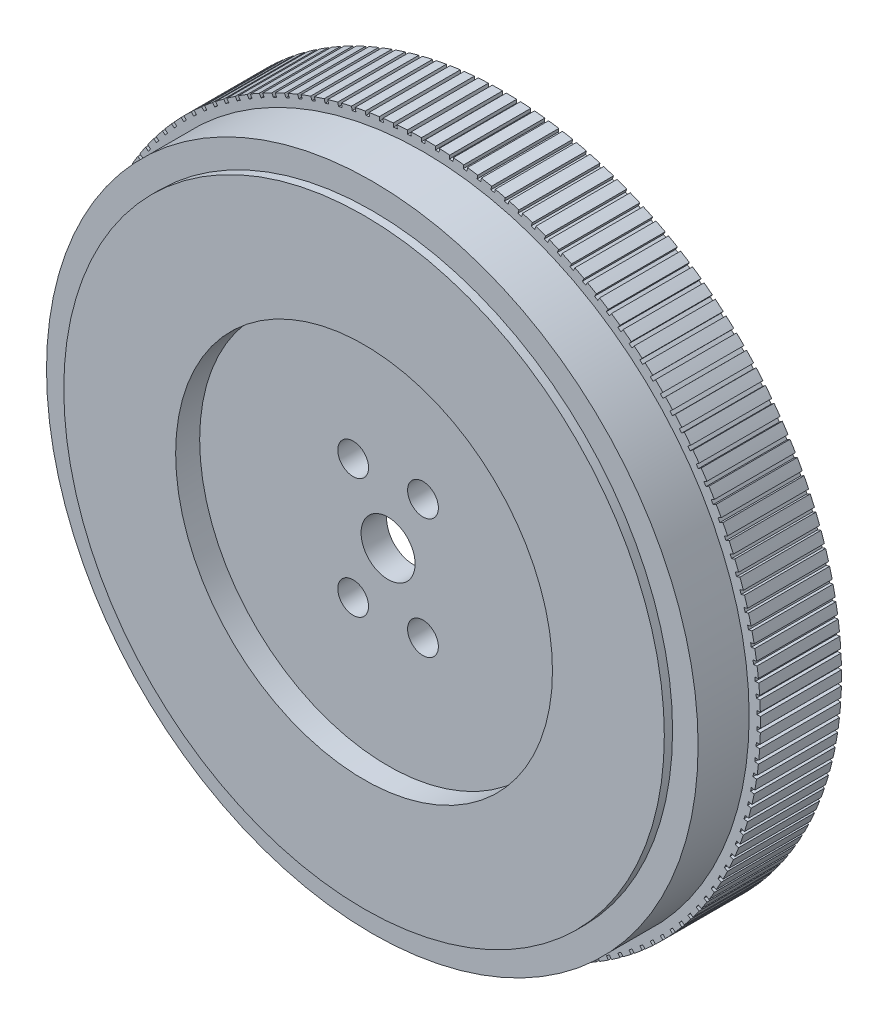
from build123d import *

# Parameters (mm, degrees)
SKETCH1_R           = 44.9
BOSS_EXTRUDE1_DEPTH = 10.8
SKETCH2_R           = 43.4
BOSS_EXTRUDE2_DEPTH = 6.8
SKETCH3_R           = 40
BOSS_EXTRUDE3_DEPTH = 1.1
SKETCH4_R           = 25.1
CUT_EXTRUDE1_DEPTH  = 3.2
SKETCH5_R           = 33.85
CUT_EXTRUDE2_DEPTH  = 12.1
SKETCH6_R           = 3.6
SKETCH6_R_2         = 2.05
CUT_EXTRUDE3_DEPTH  = 66.362603987
SKETCH7_W           = 0.5
SKETCH7_H           = 0.5
CUT_EXTRUDE4_DEPTH  = 67.194486175


with BuildPart() as part:
    # Sketch1 → Boss-Extrude1 (new body)
    with BuildSketch(Plane.XY):
        Circle(SKETCH1_R)
    extrude(amount=BOSS_EXTRUDE1_DEPTH)

    # Sketch2 → Boss-Extrude2 (add)
    with BuildSketch(Plane.XY.offset(10.8)):
        Circle(SKETCH2_R)
    extrude(amount=BOSS_EXTRUDE2_DEPTH)

    # Sketch3 → Boss-Extrude3 (add)
    with BuildSketch(Plane.XY.offset(17.6)):
        Circle(SKETCH3_R)
    extrude(amount=BOSS_EXTRUDE3_DEPTH)

    # Sketch4 → Cut-Extrude1 (cut)
    with BuildSketch(Plane.XY.offset(18.7)):
        Circle(SKETCH4_R)
    extrude(amount=-CUT_EXTRUDE1_DEPTH, mode=Mode.SUBTRACT)

    # Sketch5 → Cut-Extrude2 (cut)
    with BuildSketch(Plane(origin=(0, 0, 0), x_dir=(-1, 0, 0), z_dir=(0, 0, -1))):
        Circle(SKETCH5_R)
    extrude(amount=-CUT_EXTRUDE2_DEPTH, mode=Mode.SUBTRACT)

    # Sketch6 → Cut-Extrude3 (cut, through all)
    with BuildSketch(Plane.XY.offset(15.5)):
        Circle(SKETCH6_R)
        with Locations((4.65, 8)):
            Circle(SKETCH6_R_2)
        with Locations((-4.65, 8)):
            Circle(SKETCH6_R_2)
        with Locations((-4.65, -8)):
            Circle(SKETCH6_R_2)
        with Locations((4.65, -8)):
            Circle(SKETCH6_R_2)
    extrude(amount=-CUT_EXTRUDE3_DEPTH, mode=Mode.SUBTRACT)

    # Sketch7 → Cut-Extrude4 (cut, through all)
    with BuildSketch(Plane(origin=(0, 0, 0), x_dir=(-1, 0, 0), z_dir=(0, 0, -1))):
        Polygon((1.631584326, 44.898478744), (1.610646499, 44.398917329), (2.110207914, 44.377979502), (2.131145741, 44.877540917), align=None)
        with Locations((0, 44.67741881)):
            Rectangle(SKETCH7_W, SKETCH7_H)
        Polygon((3.510306298, 44.79077149), (3.468467376, 44.29252506), (3.966713806, 44.250686139), (4.008552727, 44.748932568), align=None)
        Polygon((5.38287, 44.604486002), (5.320203383, 44.108428652), (5.816260734, 44.045762035), (5.878927351, 44.541819385), align=None)
        Polygon((7.245990319, 44.33994909), (7.162605946, 43.846951071), (7.655603964, 43.763566698), (7.738988337, 44.256564716), align=None)
        Polygon((9.096398709, 43.997624839), (8.992442863, 43.508551039), (9.481516664, 43.404595193), (9.585472509, 43.893668994), align=None)
        Polygon((10.930848924, 43.578113804), (10.806503981, 43.093822224), (11.290795561, 42.96947728), (11.415140505, 43.453768861), align=None)
        Polygon((12.746122716, 43.08215195), (12.601606818, 42.603492201), (13.080266567, 42.458976303), (13.224782465, 42.937636052), align=None)
        Polygon((14.539035478, 42.510609362), (14.374602155, 42.038421177), (14.84679034, 41.873987853), (15.011223663, 42.346176039), align=None)
        Polygon((16.306441831, 41.86448872), (16.122379555, 41.399600477), (16.587267798, 41.2155382), (16.771330074, 41.680426443), align=None)
        Polygon((18.045241145, 41.144923539), (17.841872823, 40.68815081), (18.298645552, 40.484782488), (18.502013873, 40.941555217), align=None)
        Polygon((19.752382973, 40.35317618), (19.530065383, 39.9053203), (19.977921264, 39.683002711), (20.200238853, 40.130858591), align=None)
        Polygon((21.42487241, 39.490635639), (21.183995573, 39.052482299), (21.622148913, 38.811605462), (21.86302575, 39.249758802), align=None)
        Polygon((23.05977534, 38.558815104), (22.800761835, 38.131132974), (23.228443966, 37.872119469), (23.48745747, 38.299801599), align=None)
        Polygon((24.654223589, 37.559349305), (24.377527814, 37.142888684), (24.793988435, 36.86619291), (25.070684209, 37.28265353), align=None)
        Polygon((26.205419952, 36.493991644), (25.911527326, 36.089483147), (26.316035823, 35.795590521), (26.609928449, 36.200099018), align=None)
        Polygon((27.710643103, 35.364611121), (27.400069213, 34.972764393), (27.791915942, 34.662190502), (28.102489832, 35.054037231), align=None)
        Polygon((29.167252371, 34.173189054), (28.840542069, 33.794691526), (29.219039597, 33.467981224), (29.545749899, 33.846478752), align=None)
        Polygon((30.572692367, 32.9218156), (30.230418814, 32.557331287), (30.594903127, 32.215057734), (30.93717668, 32.579542047), align=None)
        Polygon((31.924497471, 31.612686095), (31.567261131, 31.262854425), (31.917092802, 30.905618085), (32.274329142, 31.255449756), align=None)
        Polygon((33.220296159, 30.248097197), (32.848723747, 29.913531894), (33.18328905, 29.541959481), (33.554861463, 29.876524784), align=None)
        Polygon((34.45781516, 28.830442858), (34.072558538, 28.511730863), (34.391270533, 28.126474242), (34.776527155, 28.445186237), align=None)
        Polygon((35.634883443, 27.362210125), (35.236618484, 27.059910568), (35.538918042, 26.661645609), (35.937183001, 26.963945166), align=None)
        Polygon((36.749436033, 25.845974778), (36.338861428, 25.560617995), (36.624218212, 25.15004339), (37.034792816, 25.435400174), align=None)
        Polygon((37.799517624, 24.284396809), (37.377353661, 24.016483412), (37.645267058, 23.594319449), (38.067431021, 23.862232846), align=None)
        Polygon((38.783286016, 22.680215756), (38.350273314, 22.430215756), (38.600273314, 21.997203054), (39.033286016, 22.247203054), align=None)
        Polygon((39.699015347, 21.036245898), (39.255913557, 20.80459788), (39.487561575, 20.361496091), (39.930663364, 20.593144108), align=None)
        Polygon((40.545099114, 19.355371316), (40.092685588, 19.14248167), (40.305575234, 18.690068144), (40.75798876, 18.90295779), align=None)
        Polygon((41.320053001, 17.640540836), (40.859121425, 17.446783043), (41.052879218, 16.985851467), (41.513810794, 17.17960926), align=None)
        Polygon((42.022517473, 15.894762853), (41.553876479, 15.720476829), (41.728162502, 15.251835835), (42.196803497, 15.426121858), align=None)
        Polygon((42.651260171, 14.121100055), (42.175731913, 13.966591558), (42.33024041, 13.4910633), (42.805768669, 13.645571797), align=None)
        Polygon((43.205178066, 12.322664049), (42.723596782, 12.188204139), (42.858056693, 11.706622855), (43.339637976, 11.841082765), align=None)
        Polygon((43.683299397, 10.502609903), (43.196509945, 10.388434468), (43.31068538, 9.901645016), (43.797474832, 10.015820451), align=None)
        Polygon((44.084785377, 8.66413061), (43.593641752, 8.570439953), (43.687332409, 8.079296328), (44.178476034, 8.172986985), align=None)
        Polygon((44.408931663, 6.810451489), (43.914295497, 6.737409974), (43.987337011, 6.242773808), (44.481973178, 6.315815322), align=None)
        Polygon((44.655169593, 4.944824521), (44.157908646, 4.892560289), (44.210172877, 4.395299341), (44.707433825, 4.447563573), align=None)
        Polygon((44.823067182, 3.07052265), (44.324053818, 3.039127391), (44.355449078, 2.540114026), (44.854462442, 2.571509286), align=None)
        Polygon((44.91232988, 1.19083404), (44.412439538, 1.18036283), (44.422910748, 0.680472488), (44.92280109, 0.690943698), align=None)
        Polygon((44.92280109, -0.690943698), (44.422910748, -0.680472488), (44.412439538, -1.18036283), (44.91232988, -1.19083404), align=None)
        Polygon((44.854462442, -2.571509286), (44.355449078, -2.540114026), (44.324053818, -3.039127391), (44.823067182, -3.07052265), align=None)
        Polygon((44.707433825, -4.447563573), (44.210172877, -4.395299341), (44.157908646, -4.892560289), (44.655169593, -4.944824521), align=None)
        Polygon((44.481973178, -6.315815322), (43.987337011, -6.242773808), (43.914295497, -6.737409974), (44.408931663, -6.810451489), align=None)
        Polygon((44.178476034, -8.172986985), (43.687332409, -8.079296328), (43.593641752, -8.570439953), (44.084785377, -8.66413061), align=None)
        Polygon((43.797474832, -10.015820451), (43.31068538, -9.901645016), (43.196509945, -10.388434468), (43.683299397, -10.502609903), align=None)
        Polygon((43.339637976, -11.841082765), (42.858056693, -11.706622855), (42.723596782, -12.188204139), (43.205178066, -12.322664049), align=None)
        Polygon((42.805768669, -13.645571797), (42.33024041, -13.4910633), (42.175731913, -13.966591558), (42.651260171, -14.121100055), align=None)
        Polygon((42.196803497, -15.426121858), (41.728162502, -15.251835835), (41.553876479, -15.720476829), (42.022517473, -15.894762853), align=None)
        Polygon((41.513810794, -17.17960926), (41.052879218, -16.985851467), (40.859121425, -17.446783043), (41.320053001, -17.640540836), align=None)
        Polygon((40.75798876, -18.90295779), (40.305575234, -18.690068144), (40.092685588, -19.14248167), (40.545099114, -19.355371316), align=None)
        Polygon((39.930663364, -20.593144108), (39.487561575, -20.361496091), (39.255913557, -20.80459788), (39.699015347, -21.036245898), align=None)
        Polygon((39.033286016, -22.247203054), (38.600273314, -21.997203054), (38.350273314, -22.430215756), (38.783286016, -22.680215756), align=None)
        Polygon((38.067431021, -23.862232846), (37.645267058, -23.594319449), (37.377353661, -24.016483412), (37.799517624, -24.284396809), align=None)
        Polygon((37.034792816, -25.435400174), (36.624218212, -25.15004339), (36.338861428, -25.560617995), (36.749436033, -25.845974778), align=None)
        Polygon((35.937183001, -26.963945166), (35.538918042, -26.661645609), (35.236618484, -27.059910568), (35.634883443, -27.362210125), align=None)
        Polygon((34.776527155, -28.445186237), (34.391270533, -28.126474242), (34.072558538, -28.511730863), (34.45781516, -28.830442858), align=None)
        Polygon((33.554861463, -29.876524784), (33.18328905, -29.541959481), (32.848723747, -29.913531894), (33.220296159, -30.248097197), align=None)
        Polygon((32.274329142, -31.255449756), (31.917092802, -30.905618085), (31.567261131, -31.262854425), (31.924497471, -31.612686095), align=None)
        Polygon((30.93717668, -32.579542047), (30.594903127, -32.215057734), (30.230418814, -32.557331287), (30.572692367, -32.9218156), align=None)
        Polygon((29.545749899, -33.846478752), (29.219039597, -33.467981224), (28.840542069, -33.794691526), (29.167252371, -34.173189054), align=None)
        Polygon((28.102489832, -35.054037231), (27.791915942, -34.662190502), (27.400069213, -34.972764393), (27.710643103, -35.364611121), align=None)
        Polygon((26.609928449, -36.200099018), (26.316035823, -35.795590521), (25.911527326, -36.089483147), (26.205419952, -36.493991644), align=None)
        Polygon((25.070684209, -37.28265353), (24.793988435, -36.86619291), (24.377527814, -37.142888684), (24.654223589, -37.559349305), align=None)
        Polygon((23.48745747, -38.299801599), (23.228443966, -37.872119469), (22.800761835, -38.131132974), (23.05977534, -38.558815104), align=None)
        Polygon((21.86302575, -39.249758802), (21.622148913, -38.811605462), (21.183995573, -39.052482299), (21.42487241, -39.490635639), align=None)
        Polygon((20.200238853, -40.130858591), (19.977921264, -39.683002711), (19.530065383, -39.9053203), (19.752382973, -40.35317618), align=None)
        Polygon((18.502013873, -40.941555217), (18.298645552, -40.484782488), (17.841872823, -40.68815081), (18.045241145, -41.144923539), align=None)
        Polygon((16.771330074, -41.680426443), (16.587267798, -41.2155382), (16.122379555, -41.399600477), (16.306441831, -41.86448872), align=None)
        Polygon((15.011223663, -42.346176039), (14.84679034, -41.873987853), (14.374602155, -42.038421177), (14.539035478, -42.510609362), align=None)
        Polygon((13.224782465, -42.937636052), (13.080266567, -42.458976303), (12.601606818, -42.603492201), (12.746122716, -43.08215195), align=None)
        Polygon((11.415140505, -43.453768861), (11.290795561, -42.96947728), (10.806503981, -43.093822224), (10.930848924, -43.578113804), align=None)
        Polygon((9.585472509, -43.893668994), (9.481516664, -43.404595193), (8.992442863, -43.508551039), (9.096398709, -43.997624839), align=None)
        Polygon((7.738988337, -44.256564716), (7.655603964, -43.763566698), (7.162605946, -43.846951071), (7.245990319, -44.33994909), align=None)
        Polygon((5.878927351, -44.541819385), (5.816260734, -44.045762035), (5.320203383, -44.108428652), (5.38287, -44.604486002), align=None)
        Polygon((4.008552727, -44.748932568), (3.966713806, -44.250686139), (3.468467376, -44.29252506), (3.510306298, -44.79077149), align=None)
        Polygon((2.131145741, -44.877540917), (2.110207914, -44.377979502), (1.610646499, -44.398917329), (1.631584326, -44.898478744), align=None)
        with Locations((0, -44.67741881)):
            Rectangle(SKETCH7_W, SKETCH7_H)
        Polygon((-1.631584326, -44.898478744), (-1.610646499, -44.398917329), (-2.110207914, -44.377979502), (-2.131145741, -44.877540917), align=None)
        Polygon((-3.510306298, -44.79077149), (-3.468467376, -44.29252506), (-3.966713806, -44.250686139), (-4.008552727, -44.748932568), align=None)
        Polygon((-5.38287, -44.604486002), (-5.320203383, -44.108428652), (-5.816260734, -44.045762035), (-5.878927351, -44.541819385), align=None)
        Polygon((-7.245990319, -44.33994909), (-7.162605946, -43.846951071), (-7.655603964, -43.763566698), (-7.738988337, -44.256564716), align=None)
        Polygon((-9.096398709, -43.997624839), (-8.992442863, -43.508551039), (-9.481516664, -43.404595193), (-9.585472509, -43.893668994), align=None)
        Polygon((-10.930848924, -43.578113804), (-10.806503981, -43.093822224), (-11.290795561, -42.96947728), (-11.415140505, -43.453768861), align=None)
        Polygon((-12.746122716, -43.08215195), (-12.601606818, -42.603492201), (-13.080266567, -42.458976303), (-13.224782465, -42.937636052), align=None)
        Polygon((-14.539035478, -42.510609362), (-14.374602155, -42.038421177), (-14.84679034, -41.873987853), (-15.011223663, -42.346176039), align=None)
        Polygon((-16.306441831, -41.86448872), (-16.122379555, -41.399600477), (-16.587267798, -41.2155382), (-16.771330074, -41.680426443), align=None)
        Polygon((-18.045241145, -41.144923539), (-17.841872823, -40.68815081), (-18.298645552, -40.484782488), (-18.502013873, -40.941555217), align=None)
        Polygon((-19.752382973, -40.35317618), (-19.530065383, -39.9053203), (-19.977921264, -39.683002711), (-20.200238853, -40.130858591), align=None)
        Polygon((-21.42487241, -39.490635639), (-21.183995573, -39.052482299), (-21.622148913, -38.811605462), (-21.86302575, -39.249758802), align=None)
        Polygon((-23.05977534, -38.558815104), (-22.800761835, -38.131132974), (-23.228443966, -37.872119469), (-23.48745747, -38.299801599), align=None)
        Polygon((-24.654223589, -37.559349305), (-24.377527814, -37.142888684), (-24.793988435, -36.86619291), (-25.070684209, -37.28265353), align=None)
        Polygon((-26.205419952, -36.493991644), (-25.911527326, -36.089483147), (-26.316035823, -35.795590521), (-26.609928449, -36.200099018), align=None)
        Polygon((-27.710643103, -35.364611121), (-27.400069213, -34.972764393), (-27.791915942, -34.662190502), (-28.102489832, -35.054037231), align=None)
        Polygon((-29.167252371, -34.173189054), (-28.840542069, -33.794691526), (-29.219039597, -33.467981224), (-29.545749899, -33.846478752), align=None)
        Polygon((-30.572692367, -32.9218156), (-30.230418814, -32.557331287), (-30.594903127, -32.215057734), (-30.93717668, -32.579542047), align=None)
        Polygon((-31.924497471, -31.612686095), (-31.567261131, -31.262854425), (-31.917092802, -30.905618085), (-32.274329142, -31.255449756), align=None)
        Polygon((-33.220296159, -30.248097197), (-32.848723747, -29.913531894), (-33.18328905, -29.541959481), (-33.554861463, -29.876524784), align=None)
        Polygon((-34.45781516, -28.830442858), (-34.072558538, -28.511730863), (-34.391270533, -28.126474242), (-34.776527155, -28.445186237), align=None)
        Polygon((-35.634883443, -27.362210125), (-35.236618484, -27.059910568), (-35.538918042, -26.661645609), (-35.937183001, -26.963945166), align=None)
        Polygon((-36.749436033, -25.845974778), (-36.338861428, -25.560617995), (-36.624218212, -25.15004339), (-37.034792816, -25.435400174), align=None)
        Polygon((-37.799517624, -24.284396809), (-37.377353661, -24.016483412), (-37.645267058, -23.594319449), (-38.067431021, -23.862232846), align=None)
        Polygon((-38.783286016, -22.680215756), (-38.350273314, -22.430215756), (-38.600273314, -21.997203054), (-39.033286016, -22.247203054), align=None)
        Polygon((-39.699015347, -21.036245898), (-39.255913557, -20.80459788), (-39.487561575, -20.361496091), (-39.930663364, -20.593144108), align=None)
        Polygon((-40.545099114, -19.355371316), (-40.092685588, -19.14248167), (-40.305575234, -18.690068144), (-40.75798876, -18.90295779), align=None)
        Polygon((-41.320053001, -17.640540836), (-40.859121425, -17.446783043), (-41.052879218, -16.985851467), (-41.513810794, -17.17960926), align=None)
        Polygon((-42.022517473, -15.894762853), (-41.553876479, -15.720476829), (-41.728162502, -15.251835835), (-42.196803497, -15.426121858), align=None)
        Polygon((-42.651260171, -14.121100055), (-42.175731913, -13.966591558), (-42.33024041, -13.4910633), (-42.805768669, -13.645571797), align=None)
        Polygon((-43.205178066, -12.322664049), (-42.723596782, -12.188204139), (-42.858056693, -11.706622855), (-43.339637976, -11.841082765), align=None)
        Polygon((-43.683299397, -10.502609903), (-43.196509945, -10.388434468), (-43.31068538, -9.901645016), (-43.797474832, -10.015820451), align=None)
        Polygon((-44.084785377, -8.66413061), (-43.593641752, -8.570439953), (-43.687332409, -8.079296328), (-44.178476034, -8.172986985), align=None)
        Polygon((-44.408931663, -6.810451489), (-43.914295497, -6.737409974), (-43.987337011, -6.242773808), (-44.481973178, -6.315815322), align=None)
        Polygon((-44.655169593, -4.944824521), (-44.157908646, -4.892560289), (-44.210172877, -4.395299341), (-44.707433825, -4.447563573), align=None)
        Polygon((-44.823067182, -3.07052265), (-44.324053818, -3.039127391), (-44.355449078, -2.540114026), (-44.854462442, -2.571509286), align=None)
        Polygon((-44.91232988, -1.19083404), (-44.412439538, -1.18036283), (-44.422910748, -0.680472488), (-44.92280109, -0.690943698), align=None)
        Polygon((-44.92280109, 0.690943698), (-44.422910748, 0.680472488), (-44.412439538, 1.18036283), (-44.91232988, 1.19083404), align=None)
        Polygon((-44.854462442, 2.571509286), (-44.355449078, 2.540114026), (-44.324053818, 3.039127391), (-44.823067182, 3.07052265), align=None)
        Polygon((-44.707433825, 4.447563573), (-44.210172877, 4.395299341), (-44.157908646, 4.892560289), (-44.655169593, 4.944824521), align=None)
        Polygon((-44.481973178, 6.315815322), (-43.987337011, 6.242773808), (-43.914295497, 6.737409974), (-44.408931663, 6.810451489), align=None)
        Polygon((-44.178476034, 8.172986985), (-43.687332409, 8.079296328), (-43.593641752, 8.570439953), (-44.084785377, 8.66413061), align=None)
        Polygon((-43.797474832, 10.015820451), (-43.31068538, 9.901645016), (-43.196509945, 10.388434468), (-43.683299397, 10.502609903), align=None)
        Polygon((-43.339637976, 11.841082765), (-42.858056693, 11.706622855), (-42.723596782, 12.188204139), (-43.205178066, 12.322664049), align=None)
        Polygon((-42.805768669, 13.645571797), (-42.33024041, 13.4910633), (-42.175731913, 13.966591558), (-42.651260171, 14.121100055), align=None)
        Polygon((-42.196803497, 15.426121858), (-41.728162502, 15.251835835), (-41.553876479, 15.720476829), (-42.022517473, 15.894762853), align=None)
        Polygon((-41.513810794, 17.17960926), (-41.052879218, 16.985851467), (-40.859121425, 17.446783043), (-41.320053001, 17.640540836), align=None)
        Polygon((-40.75798876, 18.90295779), (-40.305575234, 18.690068144), (-40.092685588, 19.14248167), (-40.545099114, 19.355371316), align=None)
        Polygon((-39.930663364, 20.593144108), (-39.487561575, 20.361496091), (-39.255913557, 20.80459788), (-39.699015347, 21.036245898), align=None)
        Polygon((-39.033286016, 22.247203054), (-38.600273314, 21.997203054), (-38.350273314, 22.430215756), (-38.783286016, 22.680215756), align=None)
        Polygon((-38.067431021, 23.862232846), (-37.645267058, 23.594319449), (-37.377353661, 24.016483412), (-37.799517624, 24.284396809), align=None)
        Polygon((-37.034792816, 25.435400174), (-36.624218212, 25.15004339), (-36.338861428, 25.560617995), (-36.749436033, 25.845974778), align=None)
        Polygon((-35.937183001, 26.963945166), (-35.538918042, 26.661645609), (-35.236618484, 27.059910568), (-35.634883443, 27.362210125), align=None)
        Polygon((-34.776527155, 28.445186237), (-34.391270533, 28.126474242), (-34.072558538, 28.511730863), (-34.45781516, 28.830442858), align=None)
        Polygon((-33.554861463, 29.876524784), (-33.18328905, 29.541959481), (-32.848723747, 29.913531894), (-33.220296159, 30.248097197), align=None)
        Polygon((-32.274329142, 31.255449756), (-31.917092802, 30.905618085), (-31.567261131, 31.262854425), (-31.924497471, 31.612686095), align=None)
        Polygon((-30.93717668, 32.579542047), (-30.594903127, 32.215057734), (-30.230418814, 32.557331287), (-30.572692367, 32.9218156), align=None)
        Polygon((-29.545749899, 33.846478752), (-29.219039597, 33.467981224), (-28.840542069, 33.794691526), (-29.167252371, 34.173189054), align=None)
        Polygon((-28.102489832, 35.054037231), (-27.791915942, 34.662190502), (-27.400069213, 34.972764393), (-27.710643103, 35.364611121), align=None)
        Polygon((-26.609928449, 36.200099018), (-26.316035823, 35.795590521), (-25.911527326, 36.089483147), (-26.205419952, 36.493991644), align=None)
        Polygon((-25.070684209, 37.28265353), (-24.793988435, 36.86619291), (-24.377527814, 37.142888684), (-24.654223589, 37.559349305), align=None)
        Polygon((-23.48745747, 38.299801599), (-23.228443966, 37.872119469), (-22.800761835, 38.131132974), (-23.05977534, 38.558815104), align=None)
        Polygon((-21.86302575, 39.249758802), (-21.622148913, 38.811605462), (-21.183995573, 39.052482299), (-21.42487241, 39.490635639), align=None)
        Polygon((-20.200238853, 40.130858591), (-19.977921264, 39.683002711), (-19.530065383, 39.9053203), (-19.752382973, 40.35317618), align=None)
        Polygon((-18.502013873, 40.941555217), (-18.298645552, 40.484782488), (-17.841872823, 40.68815081), (-18.045241145, 41.144923539), align=None)
        Polygon((-16.771330074, 41.680426443), (-16.587267798, 41.2155382), (-16.122379555, 41.399600477), (-16.306441831, 41.86448872), align=None)
        Polygon((-15.011223663, 42.346176039), (-14.84679034, 41.873987853), (-14.374602155, 42.038421177), (-14.539035478, 42.510609362), align=None)
        Polygon((-13.224782465, 42.937636052), (-13.080266567, 42.458976303), (-12.601606818, 42.603492201), (-12.746122716, 43.08215195), align=None)
        Polygon((-11.415140505, 43.453768861), (-11.290795561, 42.96947728), (-10.806503981, 43.093822224), (-10.930848924, 43.578113804), align=None)
        Polygon((-9.585472509, 43.893668994), (-9.481516664, 43.404595193), (-8.992442863, 43.508551039), (-9.096398709, 43.997624839), align=None)
        Polygon((-7.738988337, 44.256564716), (-7.655603964, 43.763566698), (-7.162605946, 43.846951071), (-7.245990319, 44.33994909), align=None)
        Polygon((-5.878927351, 44.541819385), (-5.816260734, 44.045762035), (-5.320203383, 44.108428652), (-5.38287, 44.604486002), align=None)
        Polygon((-4.008552727, 44.748932568), (-3.966713806, 44.250686139), (-3.468467376, 44.29252506), (-3.510306298, 44.79077149), align=None)
        Polygon((-2.131145741, 44.877540917), (-2.110207914, 44.377979502), (-1.610646499, 44.398917329), (-1.631584326, 44.898478744), align=None)
    extrude(amount=-CUT_EXTRUDE4_DEPTH, mode=Mode.SUBTRACT)


solid = part.part
